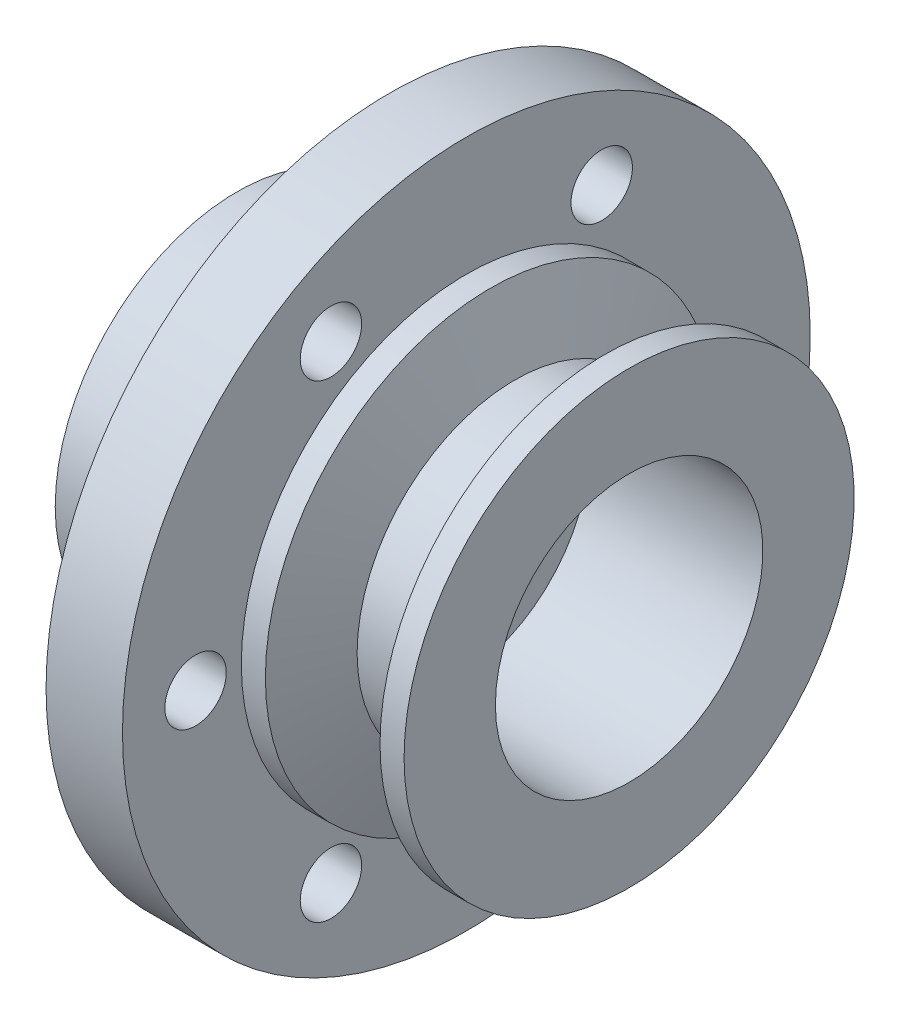
from build123d import *

# Parameters (mm, degrees)
F_1_4_20_TAPPED_HOLE1_D     = 5.1054
F_1_4_20_TAPPED_HOLE1_DEPTH = 16.51
F_1_4_20_TAPPED_HOLE1_TIP   = 1.533816902


with BuildPart() as part:
    # Sketch1 → Revolve1 (revolve)
    with BuildSketch(Plane.XY):
        Polygon((-12.7, 15.112500017), (0, 15.112500017), (0, 28.575), (6.35, 28.575), (6.35, 18.7005), (8.35, 18.7005), (10.383865669, 13.1125), (15.841134331, 13.1125), (17.875, 18.7005), (19.875000096, 18.7005), (19.875000096, 11.1125), (5.412500096, 11.1125), (5.412500096, 8.9375), (1.5875, 8.9375), (1.5875, 11.1125), (-12.7, 11.1125), align=None)
    revolve(axis=Axis((0, 0, 0), (1, 0, 0)))

    # 1/4-20 Tapped Hole1
    with Locations(Plane.ZY):
        with Locations((-11.25, -19.485571585), (-22.5, 0), (-11.25, 19.485571585), (11.25, 19.485571585), (22.5, 0), (11.25, -19.485571585)):
            Hole(F_1_4_20_TAPPED_HOLE1_D / 2, depth=F_1_4_20_TAPPED_HOLE1_DEPTH)
            with Locations((0, 0, -(F_1_4_20_TAPPED_HOLE1_DEPTH + F_1_4_20_TAPPED_HOLE1_TIP / 2))):  # 118° drill point
                Cone(0, F_1_4_20_TAPPED_HOLE1_D / 2, F_1_4_20_TAPPED_HOLE1_TIP, mode=Mode.SUBTRACT)


solid = part.part
